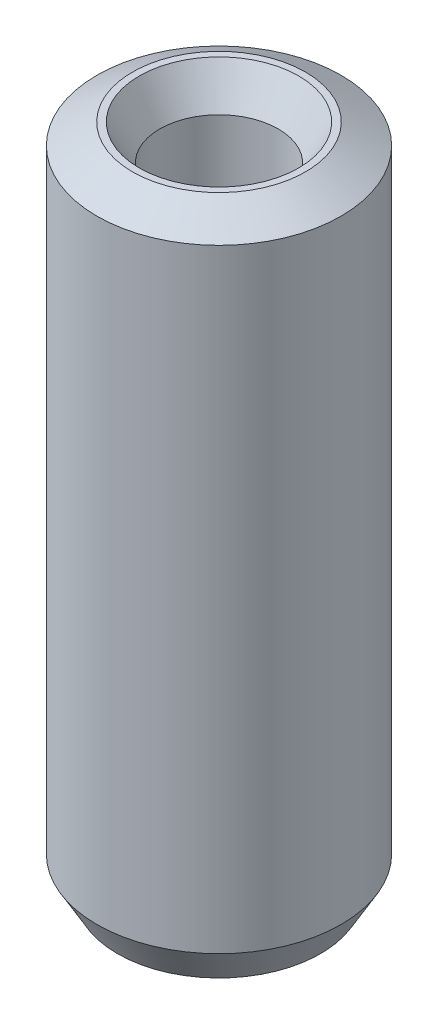
from build123d import *
from OCP.BRepFilletAPI import BRepFilletAPI_MakeChamfer

# Parameters (mm, degrees)
SKETCH1_R           = 17.5
BOSS_EXTRUDE1_DEPTH = 95.980784228
SKETCH2_R           = 8.482991734
CUT_EXTRUDE1_DEPTH  = 100.120184327
CHAMFER1_SIZE       = 2.94441712
CHAMFER1_SIZE2      = 5.099880051


with BuildPart() as part:
    # Sketch1 → Boss-Extrude1 (new body)
    with BuildSketch(Plane(origin=(0, 0, 0), x_dir=(1, 0, 0), z_dir=(0, 1, 0))):
        Circle(SKETCH1_R)
    extrude(amount=BOSS_EXTRUDE1_DEPTH)

    # Sketch2 → Cut-Extrude1 (cut, through all)
    with BuildSketch(Plane(origin=(0, 0, 0), x_dir=(1, 0, 0), z_dir=(0, 1, 0))):
        Circle(SKETCH2_R)
    extrude(amount=CUT_EXTRUDE1_DEPTH, mode=Mode.SUBTRACT)

    # Chamfer1: one chamfer whose edges measure the first distance from different faces: ONE call of the kernel's chamfer builder (chamfer() names one face for all edges)
    chamfer1_edges_1 = [part.edges().sort_by_distance(p)[0] for p in [
        (-8.482991734, 95.980784228, 0),
    ]]
    chamfer1_side_1 = [part.faces().sort_by_distance(p)[0] for p in [
        (-17.005025253, 95.980784228, 0),
    ]]
    chamfer1_edges_2 = [part.edges().sort_by_distance(p)[0] for p in [
        (-8.482991734, 0, 0),
    ]]
    chamfer1_side_2 = [part.faces().sort_by_distance(p)[0] for p in [
        (-8.482991734, 47.990392114, 0),
    ]]
    chamfer1_edges_3 = [part.edges().sort_by_distance(p)[0] for p in [
        (-17.5, 0, 0),
    ]]
    chamfer1_side_3 = [part.faces().sort_by_distance(p)[0] for p in [
        (-17.005025253, 0, 0),
    ]]
    chamfer1_edges_4 = [part.edges().sort_by_distance(p)[0] for p in [
        (-17.5, 95.980784228, 0),
    ]]
    chamfer1_side_4 = [part.faces().sort_by_distance(p)[0] for p in [
        (-17.5, 47.990392114, 0),
    ]]
    chamfer1 = BRepFilletAPI_MakeChamfer(part.part.solid().wrapped)
    for e in chamfer1_edges_1:
        chamfer1.Add(CHAMFER1_SIZE, CHAMFER1_SIZE2, e.wrapped, chamfer1_side_1[0].wrapped)  # the first distance lies on this face
    for e in chamfer1_edges_2:
        chamfer1.Add(CHAMFER1_SIZE, CHAMFER1_SIZE2, e.wrapped, chamfer1_side_2[0].wrapped)  # the first distance lies on this face
    for e in chamfer1_edges_3:
        chamfer1.Add(CHAMFER1_SIZE, CHAMFER1_SIZE2, e.wrapped, chamfer1_side_3[0].wrapped)  # the first distance lies on this face
    for e in chamfer1_edges_4:
        chamfer1.Add(CHAMFER1_SIZE, CHAMFER1_SIZE2, e.wrapped, chamfer1_side_4[0].wrapped)  # the first distance lies on this face
    add(Compound.cast(chamfer1.Shape()), mode=Mode.REPLACE)


solid = part.part
